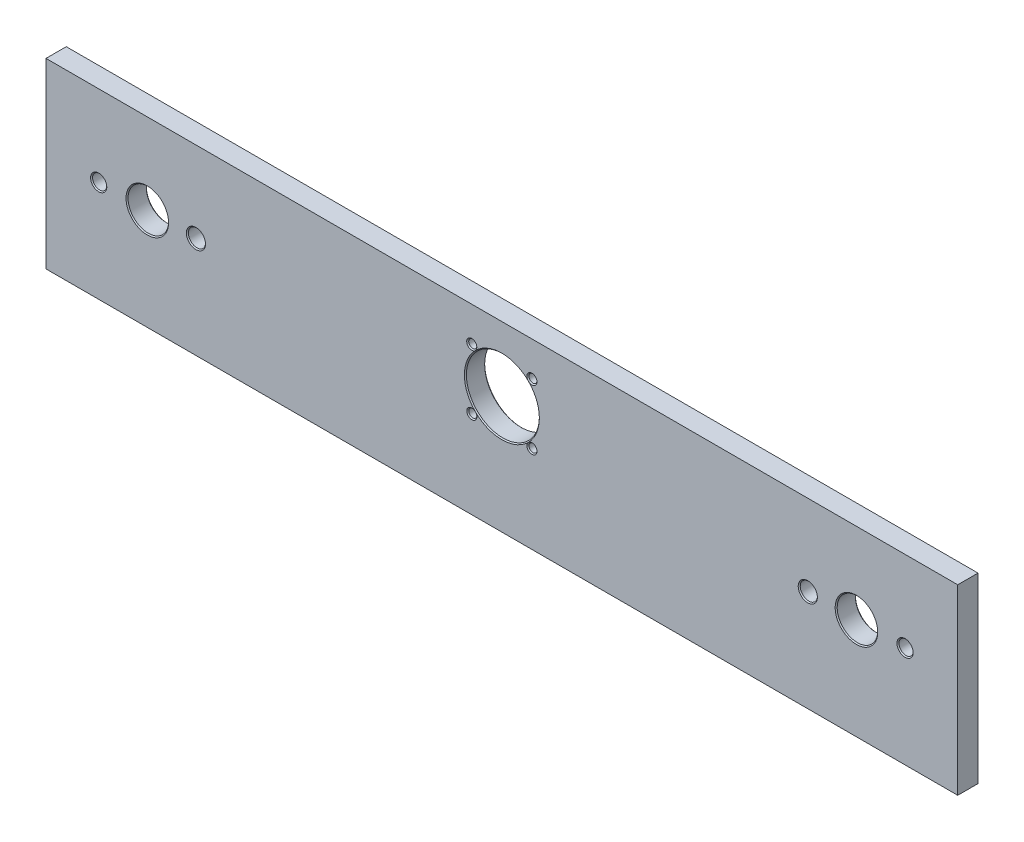
from build123d import *

# Parameters (mm, degrees)
CROQUIS2_W              = 450
CROQUIS2_H              = 90
SALIENTE_EXTRUIR1_DEPTH = 10
CROQUIS6_R              = 18
CROQUIS6_R_2            = 2
CORTAR_EXTRUIR1_DEPTH   = 460.020696701
CHAFL_N5_SIZE           = 0.5
CROQUIS10_R             = 3.5
CROQUIS10_R_2           = 4.234641279
CROQUIS10_R_3           = 10
CORTAR_EXTRUIR3_DEPTH   = 460.020696701
CHAFL_N6_SIZE           = 0.5


with BuildPart() as part:
    # Croquis2 → Saliente-Extruir1 (new body)
    with BuildSketch(Plane.XY):
        with Locations((225, 45)):
            Rectangle(CROQUIS2_W, CROQUIS2_H)
    extrude(amount=SALIENTE_EXTRUIR1_DEPTH)

    # Croquis6 → Cortar-Extruir1 (cut, through all)
    with BuildSketch(Plane.XY.offset(10)):
        with Locations((225, 58)):
            Circle(CROQUIS6_R)
        with Locations((210.140026495, 72.838503544)):
            Circle(CROQUIS6_R_2)
        with Locations((239.838503544, 72.859973505)):
            Circle(CROQUIS6_R_2)
        with Locations((239.859973505, 43.161496456)):
            Circle(CROQUIS6_R_2)
        with Locations((210.161496456, 43.140026495)):
            Circle(CROQUIS6_R_2)
    extrude(amount=-CORTAR_EXTRUIR1_DEPTH, mode=Mode.SUBTRACT)

    # Chaflán5
    chafl_n5_edges = [part.edges().sort_by_distance(p)[0] for p in [
        (207, 58, 0),
        (207, 58, 10),
        (208.140026495, 72.838503544, 0),
        (208.140026495, 72.838503544, 10),
        (237.838503544, 72.859973505, 0),
        (237.838503544, 72.859973505, 10),
        (237.859973505, 43.161496456, 0),
        (237.859973505, 43.161496456, 10),
        (208.161496456, 43.140026495, 0),
        (208.161496456, 43.140026495, 10),
    ]]
    chamfer(chafl_n5_edges, length=CHAFL_N5_SIZE - 0.0001)  # a hair under: the kernel refuses the full size

    # Croquis10 → Cortar-Extruir3 (cut, through all)
    with BuildSketch(Plane.XY.offset(10)):
        with Locations((26, 50)):
            Circle(CROQUIS10_R)
        with Locations((74, 50)):
            Circle(CROQUIS10_R_2)
        with Locations(Location((376, 50, 0), (0, 0, 180))):
            Circle(CROQUIS10_R_2)
        with Locations(Location((400, 50, 0), (0, 0, 180))):
            Circle(CROQUIS10_R_3)
        with Locations((50, 50)):
            Circle(CROQUIS10_R_3)
        with Locations(Location((424, 50, 0), (0, 0, 180))):
            Circle(CROQUIS10_R)
    extrude(amount=-CORTAR_EXTRUIR3_DEPTH, mode=Mode.SUBTRACT)

    # Chaflán6
    chafl_n6_edges = [part.edges().sort_by_distance(p)[0] for p in [
        (427.5, 50, 0),
        (427.5, 50, 10),
        (22.5, 50, 0),
        (22.5, 50, 10),
        (69.765358721, 50, 0),
        (69.765358721, 50, 10),
        (380.234641279, 50, 0),
        (380.234641279, 50, 10),
        (410, 50, 0),
        (410, 50, 10),
        (40, 50, 0),
        (40, 50, 10),
    ]]
    chamfer(chafl_n6_edges, length=CHAFL_N6_SIZE)


solid = part.part
